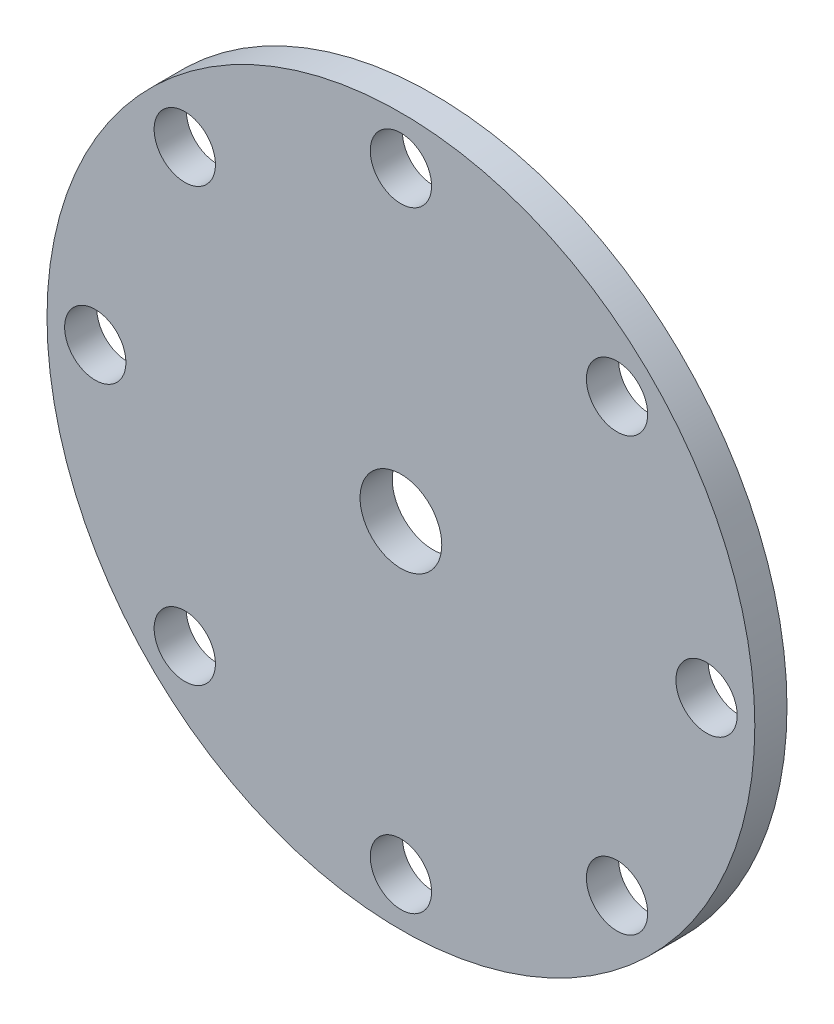
from build123d import *

# Parameters (mm, degrees)
SKETCH1_R        = 55
SKETCH1_R_2      = 4.7625
SKETCH1_R_3      = 6.35
ROTOR_DISC_DEPTH = 5


with BuildPart() as part:
    # Sketch1 → Rotor Disc (new body)
    with BuildSketch(Plane.XY):
        Circle(SKETCH1_R)
        with Locations((-33.587572106, -33.587572106)):
            Circle(SKETCH1_R_2, mode=Mode.SUBTRACT)
        with Locations((-47.5, 0)):
            Circle(SKETCH1_R_2, mode=Mode.SUBTRACT)
        with Locations((0, -47.5)):
            Circle(SKETCH1_R_2, mode=Mode.SUBTRACT)
        with Locations((33.587572106, -33.587572106)):
            Circle(SKETCH1_R_2, mode=Mode.SUBTRACT)
        with Locations((-33.587572106, 33.587572106)):
            Circle(SKETCH1_R_2, mode=Mode.SUBTRACT)
        Circle(SKETCH1_R_3, mode=Mode.SUBTRACT)
        with Locations((47.5, 0)):
            Circle(SKETCH1_R_2, mode=Mode.SUBTRACT)
        with Locations((0, 47.5)):
            Circle(SKETCH1_R_2, mode=Mode.SUBTRACT)
        with Locations((33.587572106, 33.587572106)):
            Circle(SKETCH1_R_2, mode=Mode.SUBTRACT)
    extrude(amount=ROTOR_DISC_DEPTH)


solid = part.part
